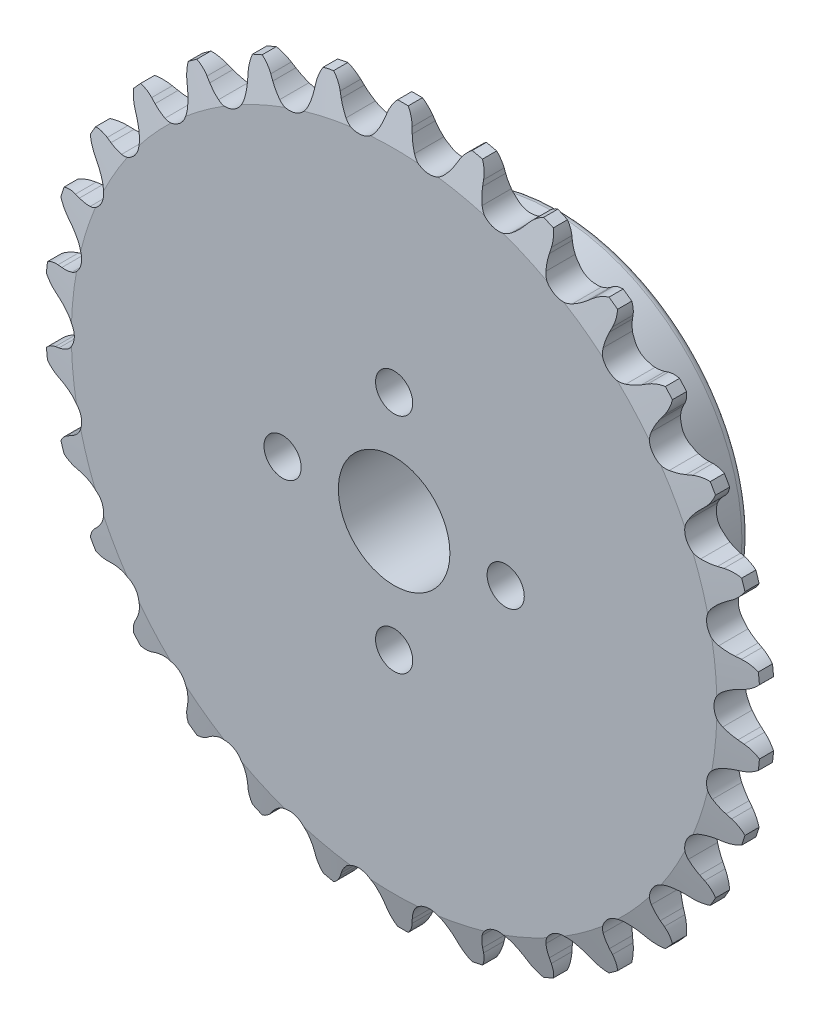
from build123d import *

# Parameters (mm, degrees)
CUT_EXTRUDE1_DEPTH          = 69.155591667
CIRPATTERN1_COUNT           = 30
SKETCH7_R                   = 25.5
BOSS_EXTRUDE1_DEPTH         = 18
CUT_EXTRUDE2_DEPTH          = 71.901203509
CUT_EXTRUDE2_DEPTH_BACK     = 71.901203509
SKETCH3_OUTSIDE_W           = 125.5
SKETCH3_OUTSIDE_H           = 125.896
SKETCH3_OUTSIDE_R           = 48.133
SKETCH3_OUTSIDE_R_2         = 7.5
TAP_DRILL_FOR_M6X1_0_TAP1_D = 5
CIRPATTERN2_COUNT           = 4
FILLET1_R                   = 1


with BuildPart() as part:
    # Sketch1 → Revolve1 (revolve)
    with BuildSketch(Plane(origin=(0, 0, 0), x_dir=(0, 0, -1), z_dir=(1, 0, 0))):
        Polygon((2.1336, 0), (-2.1336, 0), (-2.1336, 43.407160713), (-0.942975, 48.169660713), (0.942975, 48.169660713), (2.1336, 43.407160713), align=None)
    revolve(axis=Axis((0, 0, -2.1336), (0, 0, 1)))

    # Sketch0 → Cut-Extrude1 (cut, symmetric)
    with BuildSketch(Plane.XY):
        with BuildLine():
            Line((8.008399497, -45.713317718), (7.694113983, -45.092932861))
            ThreePointArc((7.694113983, -45.092932861), (7.216003843, -44.294069029), (6.630523625, -43.570200502))
            ThreePointArc((6.630523625, -43.570200502), (4.495513399, -42.771952888), (2.573123281, -43.996650462))
            ThreePointArc((2.573123281, -43.996650462), (2.150937939, -44.826428907), (1.849368783, -45.707240336))
            Line((1.849368783, -45.707240336), (1.670936426, -46.379411928))
            ThreePointArc((1.670936426, -46.379411928), (0.100345022, -48.673885505), (-2.564895945, -49.466259748))
            ThreePointArc((-2.564895945, -49.466259748), (5.177578253, -49.261366487), (12.793460518, -47.852031437))
            ThreePointArc((12.793460518, -47.852031437), (10.021717592, -47.631107228), (8.008399497, -45.713317718))
        make_face()
    cut_extrude1 = extrude(amount=CUT_EXTRUDE1_DEPTH, both=True, mode=Mode.SUBTRACT)

    # CirPattern1: Cut-Extrude1 ×30 about axis
    cirpattern1_axis = Axis((0, 0, -2.1336), (0, 0, -1))
    for i in range(1, CIRPATTERN1_COUNT):
        add(cut_extrude1.rotate(cirpattern1_axis, i * 360 / CIRPATTERN1_COUNT), mode=Mode.SUBTRACT)

    # Sketch7 → Boss-Extrude1 (add)
    with BuildSketch(Plane(origin=(0, 0, -2.1336), x_dir=(-1, 0, 0), z_dir=(0, 0, -1))):
        Circle(SKETCH7_R)
    extrude(amount=BOSS_EXTRUDE1_DEPTH)

    # Sketch3 outside → Cut-Extrude2 (cut, two sides: drawn at the far end of the back side and taken through both)
    # profile 1 of 2: a face of its own
    with BuildSketch(Plane.XY.offset(-CUT_EXTRUDE2_DEPTH_BACK)):
        Rectangle(SKETCH3_OUTSIDE_W, SKETCH3_OUTSIDE_H)
        Circle(SKETCH3_OUTSIDE_R, mode=Mode.SUBTRACT)
    # profile 2 of 2: a face of its own
    with BuildSketch(Plane.XY.offset(-CUT_EXTRUDE2_DEPTH_BACK)):
        Circle(SKETCH3_OUTSIDE_R_2)
    extrude(amount=CUT_EXTRUDE2_DEPTH + CUT_EXTRUDE2_DEPTH_BACK, mode=Mode.SUBTRACT)

    # Tap Drill for M6x1.0 Tap1 (through all)
    with Locations(Plane.XY.offset(2.1336)):
        with Locations((0, 15)):
            tap_drill_for_m6x1_0_tap1 = Hole(TAP_DRILL_FOR_M6X1_0_TAP1_D / 2)

    # CirPattern2: Tap Drill for M6x1.0 Tap1 ×4 about axis
    cirpattern2_axis = Axis((0, 0, 2.1336), (0, 0, 1))
    for i in range(1, CIRPATTERN2_COUNT):
        add(tap_drill_for_m6x1_0_tap1.rotate(cirpattern2_axis, i * 360 / CIRPATTERN2_COUNT), mode=Mode.SUBTRACT)

    # Fillet1
    fillet1_edges = [part.edges().sort_by_distance(p)[0] for p in [
        (25.5, 0, -20.1336),
        (25.5, 0, -2.1336),
    ]]
    fillet(fillet1_edges, radius=FILLET1_R)


solid = part.part
